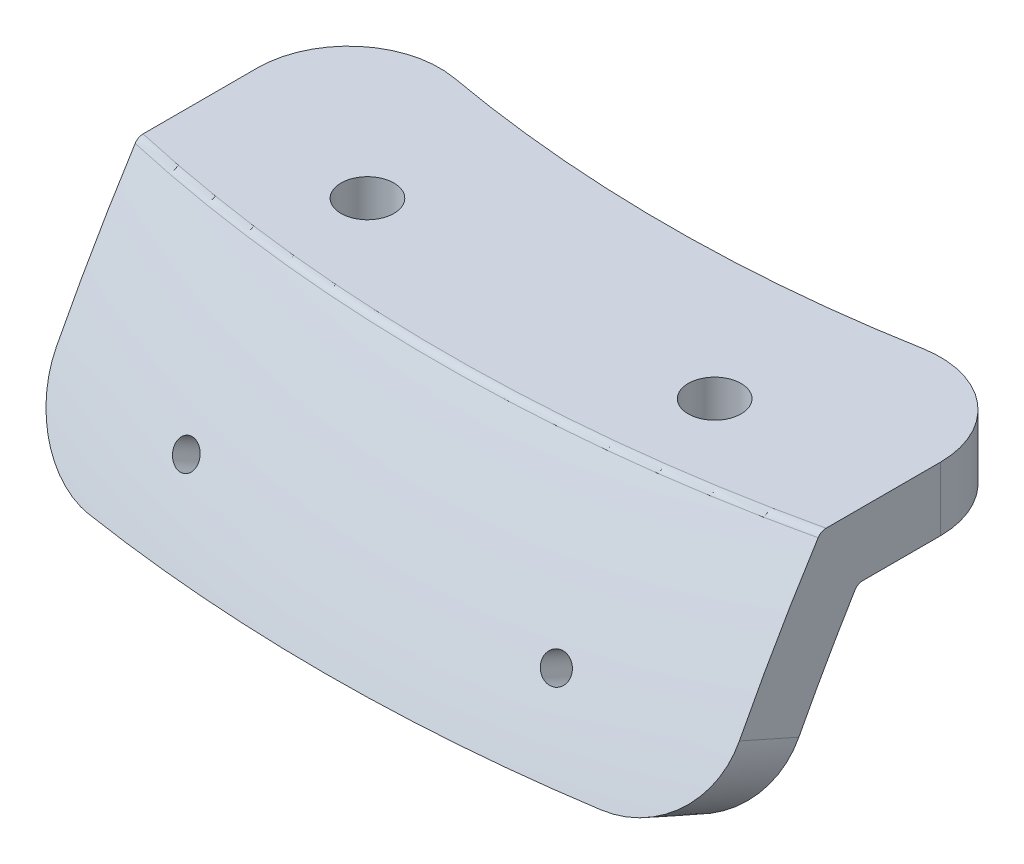
from build123d import *

# Parameters (mm, degrees)
REVOLVE1_ANGLE     = 30.000000000000068
SKETCH5_OUTSIDE_W  = 117.778
SKETCH5_OUTSIDE_H  = 65.886
CUT_EXTRUDE2_DEPTH = 260.7614913542151
FILLET1_R          = 10
FILLET2_R          = 1
SKETCH6_R          = 2.9000000000000363
CUT_EXTRUDE3_DEPTH = 189.0707041926983


with BuildPart() as part:
    # Sketch1 → Revolve1 (revolve, symmetric)
    with BuildSketch(Plane(origin=(0, 0, 0), x_dir=(0, 0, -1), z_dir=(1, 0, 0))) as revolve1_sk:
        with BuildLine():
            Line((-182.35774731017034, 155.06255496026887), (-175.9760238697444, 152.1861673073405))
            ThreePointArc((-175.9760238697444, 152.1861673073405), (-171.12326361518225, 162.17531665807525), (-165.70405663774085, 171.86884968660476))
            Line((-165.70405663774085, 171.86884968660476), (-144.78715490839105, 171.8688496866048))
            Line((-144.78715490839105, 171.8688496866048), (-144.78715490839105, 178.8688496866048))
            Line((-144.78715490839105, 178.8688496866048), (-169.62958874996124, 178.86884968660476))
            ThreePointArc((-169.62958874996124, 178.86884968660476), (-176.39573720423718, 167.1806706862104), (-182.35774731017034, 155.06255496026887))
        make_face()
    revolve(axis=Axis((0, 0, 0), (0, 1, 0)), revolution_arc=REVOLVE1_ANGLE / 2)
    revolve(revolve1_sk.sketch, axis=Axis((0, 0, 0), (0, -1, 0)), revolution_arc=REVOLVE1_ANGLE / 2)

    # Sketch4 → Cut-Revolve1 (revolve, cut)
    with BuildSketch(Plane(origin=(0, 57.85077924674397, -29.47644429930001), x_dir=(0, 0.4539904997395446, 0.891006524188369), z_dir=(0, -0.891006524188369, 0.4539904997395446))):
        Polygon((200.3216852155454, 19.031606271083962), (239.0176946479082, 22.417068420107935), (239.1484282620297, 20.922776372970326), (200.4524188296669, 17.53731422394635), align=None)
    cut_revolve1 = revolve(axis=Axis((-17.53731422394635, 148.85427304522494, 149.12796866727265), (-0.08715574274765833, 0.4522629288245563, 0.8876159753616077)), mode=Mode.SUBTRACT)

    # Mirror1: Cut-Revolve1 across plane
    add(cut_revolve1.mirror(Plane(origin=(0, 0, 0), x_dir=(0, 0, 1), z_dir=(1, 0, 0))), mode=Mode.SUBTRACT)

    # Sketch5 outside → Cut-Extrude2 (cut, through all)
    with BuildSketch(Plane(origin=(0, 0, 0), x_dir=(1, 0, 0), z_dir=(0, 1, 0))):
        with Locations((0, -161.106)):
            Rectangle(SKETCH5_OUTSIDE_W, SKETCH5_OUTSIDE_H)
        Polygon((37.4736731765006, -139.85365224093093), (-37.47367317650061, -139.85365224093093), (-37.473673176500604, -182.35774731017028), (37.473673176500604, -182.35774731017028), align=None, mode=Mode.SUBTRACT)
    extrude(amount=CUT_EXTRUDE2_DEPTH, mode=Mode.SUBTRACT)

    # Fillet1
    fillet1_edges = [part.edges().sort_by_distance(p)[0] for p in [
        (-37.473673176500604, 175.3688496866048, 139.85365224093093),
        (37.473673176500604, 175.3688496866048, 139.85365224093093),
        (-37.473673176500604, 153.6238703907979, 175.20304381237642),
        (37.473673176500604, 153.6238703907979, 175.2030438123766),
    ]]
    fillet(fillet1_edges, radius=FILLET1_R)

    # Fillet2
    fillet2_edges = [part.edges().sort_by_distance(p)[0] for p in [
        (-7.11e-15, 178.8688496866048, 169.62958874996127),
        (1.421e-14, 171.86884968660473, 165.70405663774085),
    ]]
    fillet(fillet2_edges, radius=FILLET2_R)

    # Sketch6 → Cut-Extrude3 (cut, through all)
    with BuildSketch(Plane(origin=(0, 178.86884968660476, 0), x_dir=(1, 0, 0), z_dir=(0, 1, 0))):
        with Locations((19.049999999999898, -158.67424557151682)):
            Circle(SKETCH6_R)
        with Locations((-19.050000000000104, -158.67424557151682)):
            Circle(SKETCH6_R)
    extrude(amount=-CUT_EXTRUDE3_DEPTH, mode=Mode.SUBTRACT)


solid = part.part
